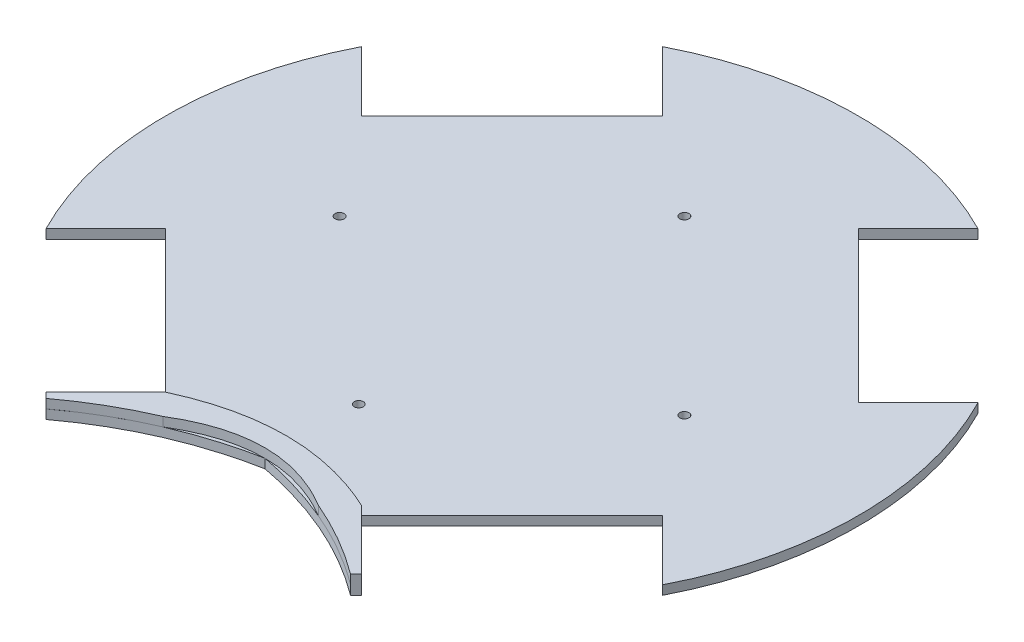
from build123d import *

# Parameters (mm, degrees)
BOSS_EXTRUDE1_DEPTH  = 3
CUT_EXTRUDE2_START   = -3
CUT_EXTRUDE2_DEPTH   = 3
CUT_EXTRUDE3_DEPTH   = 3
BOSS_EXTRUDE22_START = -3
BOSS_EXTRUDE22_DEPTH = 3
BOSS_EXTRUDE23_DEPTH = 3
BOSS_EXTRUDE25_DEPTH = 3
SKETCH9_R            = 1.5
CUT_EXTRUDE7_DEPTH   = 3


# Read off the part's stored shape, not the designer's step: Boss-Extrude22
with BuildPart() as part:
    # Sketch1 → Boss-Extrude1 (new body)
    with BuildSketch(Plane(origin=(0, 0, 0), x_dir=(1, 0, 0), z_dir=(0, 1, 0))):
        with BuildLine():
            Line((-101.290691251, -51.793216568), (-81.630943295, -32.133468612))
            Line((-81.630943295, -32.133468612), (-113.764411907, 0))
            ThreePointArc((-113.764411907, 0), (-110.602028323, -26.637055906), (-101.290691251, -51.793216568))
        make_face()
        with BuildLine():
            ThreePointArc((-101.290691251, 51.793216568), (-110.602028323, 26.637055906), (-113.764411907, 0))
            Line((-113.764411907, 0), (-81.630943295, 32.133468612))
            Line((-81.630943295, 32.133468612), (-101.290691251, 51.793216568))
        make_face()
        with BuildLine():
            Line((-51.793216568, 101.290691251), (-32.133468612, 81.630943295))
            Line((-32.133468612, 81.630943295), (0, 113.764411907))
            ThreePointArc((0, 113.764411907), (-26.637055906, 110.602028323), (-51.793216568, 101.290691251))
        make_face()
        with BuildLine():
            Line((0, 113.764411907), (32.133468612, 81.630943295))
            Line((32.133468612, 81.630943295), (51.793216568, 101.290691251))
            ThreePointArc((51.793216568, 101.290691251), (26.637055906, 110.602028323), (0, 113.764411907))
        make_face()
        with BuildLine():
            Line((101.290691251, 51.793216568), (81.630943295, 32.133468612))
            Line((81.630943295, 32.133468612), (113.764411907, 0))
            ThreePointArc((113.764411907, 0), (110.602028323, 26.637055906), (101.290691251, 51.793216568))
        make_face()
        with BuildLine():
            Line((113.764411907, 0), (81.630943295, -32.133468612))
            Line((81.630943295, -32.133468612), (101.290691251, -51.793216568))
            ThreePointArc((101.290691251, -51.793216568), (110.602028323, -26.637055906), (113.764411907, 0))
        make_face()
        with BuildLine():
            Line((32.133468612, -81.630943295), (0, -113.764411907))
            ThreePointArc((0, -113.764411907), (26.637055906, -110.602028323), (51.793216568, -101.290691251))
            Line((51.793216568, -101.290691251), (32.133468612, -81.630943295))
        make_face()
        Polygon((0, 49.497474683), (-49.497474683, 0), (0, -49.497474683), (49.497474683, 0), align=None)
        Polygon((-81.630943295, -32.133468612), (-56.882205953, -56.882205953), (-32.133468612, -81.630943295), (0, -49.497474683), (-49.497474683, 0), align=None)
        Polygon((-113.764411907, 0), (-81.630943295, -32.133468612), (-49.497474683, 0), (-81.630943295, 32.133468612), align=None)
        Polygon((-32.133468612, 81.630943295), (0, 49.497474683), (32.133468612, 81.630943295), (0, 113.764411907), align=None)
        Polygon((-81.630943295, 32.133468612), (-49.497474683, 0), (0, 49.497474683), (-32.133468612, 81.630943295), align=None)
        Polygon((32.133468612, 81.630943295), (0, 49.497474683), (49.497474683, 0), (81.630943295, 32.133468612), (56.882205953, 56.882205953), align=None)
        Polygon((49.497474683, 0), (0, -49.497474683), (32.133468612, -81.630943295), (56.882205953, -56.882205953), (81.630943295, -32.133468612), align=None)
        Polygon((0, -49.497474683), (-32.133468612, -81.630943295), (0, -113.764411907), (32.133468612, -81.630943295), align=None)
        with BuildLine():
            Line((0, -113.764411907), (-32.133468612, -81.630943295))
            Line((-32.133468612, -81.630943295), (-51.793216568, -101.290691251))
            ThreePointArc((-51.793216568, -101.290691251), (-26.637055906, -110.602028323), (0, -113.764411907))
        make_face()
        Polygon((81.630943295, 32.133468612), (49.497474683, 0), (81.630943295, -32.133468612), (113.764411907, 0), align=None)
    extrude(amount=BOSS_EXTRUDE1_DEPTH)

    # Sketch2 → Cut-Extrude2 (cut)
    with BuildSketch(Plane(origin=(0, 3, 0), x_dir=(1, 0, 0), z_dir=(0, 1, 0)).offset(CUT_EXTRUDE2_START)):
        with BuildLine():
            Line((51.793216568, -101.290691251), (78.845781166, -111.980028466))
            Line((78.845781166, -111.980028466), (0, -134.894819764))
            Line((0, -134.894819764), (-52.523649098, -101.502975393))
            Line((-52.523649098, -101.502975393), (-51.793216568, -101.290691251))
            ThreePointArc((-51.793216568, -101.290691251), (0, -113.764411907), (51.793216568, -101.290691251))
        make_face()
        with BuildLine():
            ThreePointArc((-51.793216568, -101.290691251), (-26.637055906, -110.602028323), (0, -113.764411907))
            Line((0, -113.764411907), (0, -93.764411907))
            add(Edge.make_bspline(
                [(-51.793216568, -101.290691251), (-34.528811045, -96.273171688), (-17.264405523, -93.764411907), (0, -93.764411907)],
                knots=[0, 0, 0, 0, 0.5, 0.5, 0.5, 0.5], degree=3))
        make_face()
        with BuildLine():
            Line((0, -93.764411907), (0, -113.764411907))
            ThreePointArc((0, -113.764411907), (26.637055906, -110.602028323), (51.793216568, -101.290691251))
            add(Edge.make_bspline(
                [(0, -93.764411907), (17.264405523, -93.764411907), (34.528811045, -96.273171688), (51.793216568, -101.290691251)],
                knots=[0.5, 0.5, 0.5, 0.5, 1, 1, 1, 1], degree=3))
        make_face()
    extrude(amount=CUT_EXTRUDE2_DEPTH, mode=Mode.SUBTRACT)

    # Sketch3 → Cut-Extrude3 (cut)
    with BuildSketch(Plane(origin=(0, 3, 0), x_dir=(1, 0, 0), z_dir=(0, 1, 0))):
        with BuildLine():
            add(Edge.make_bspline(
                [(-51.793216568, -101.290691251), (-25.896608284, -81.13041494), (0, -81.13041494)],
                knots=[0, 0, 0, 0.5, 0.5, 0.5], degree=2))
            add(Edge.make_bspline(
                [(-51.793216568, -101.290691251), (-34.528811045, -96.273171688), (-17.264405523, -93.764411907), (0, -93.764411907)],
                knots=[0, 0, 0, 0, 0.5, 0.5, 0.5, 0.5], degree=3))
            Line((0, -93.764411907), (0, -81.13041494))
        make_face()
        with BuildLine():
            add(Edge.make_bspline(
                [(0, -81.13041494), (25.896608284, -81.13041494), (51.793216568, -101.290691251)],
                knots=[0.5, 0.5, 0.5, 1, 1, 1], degree=2))
            Line((0, -81.13041494), (0, -93.764411907))
            add(Edge.make_bspline(
                [(0, -93.764411907), (17.264405523, -93.764411907), (34.528811045, -96.273171688), (51.793216568, -101.290691251)],
                knots=[0.5, 0.5, 0.5, 0.5, 1, 1, 1, 1], degree=3))
        make_face()
        with BuildLine():
            add(Edge.make_bspline(
                [(-51.793216568, -101.290691251), (-34.528811045, -96.273171688), (-17.264405523, -93.764411907), (0, -93.764411907)],
                knots=[0, 0, 0, 0, 0.5, 0.5, 0.5, 0.5], degree=3))
            Line((-51.793216568, -101.290691251), (0, -101.290691251))
            Line((0, -101.290691251), (0, -93.764411907))
        make_face()
        with BuildLine():
            Line((0, -93.764411907), (0, -101.290691251))
            Line((0, -101.290691251), (51.793216568, -101.290691251))
            add(Edge.make_bspline(
                [(0, -93.764411907), (17.264405523, -93.764411907), (34.528811045, -96.273171688), (51.793216568, -101.290691251)],
                knots=[0.5, 0.5, 0.5, 0.5, 1, 1, 1, 1], degree=3))
        make_face()
    extrude(amount=-CUT_EXTRUDE3_DEPTH, mode=Mode.SUBTRACT)

    # Boss-Extrude22 outline → Boss-Extrude22 (add)
    with BuildSketch(Plane(origin=(0, 3, 0), x_dir=(1, 0, 0), z_dir=(0, 1, 0)).offset(BOSS_EXTRUDE22_START)):
        with BuildLine():
            add(Edge.make_bspline(
                [(-51.793216568, -101.290691251), (-25.896608283, -81.130414939), (2e-09, -81.13041494)],
                knots=[0, 0, 0, 0.5, 0.5, 0.5], degree=2))
            Line((-51.793216568, -101.290691251), (-50.025449615, -103.058458204))
            add(Edge.make_bspline(
                [(-50.025449615, -103.058458204), (-27.497808858, -86.339849844), (2e-09, -81.13041494)],
                knots=[0, 0, 0, 1, 1, 1], degree=2))
        make_face()
        with BuildLine():
            add(Edge.make_bspline(
                [(2e-09, -81.13041494), (25.896608285, -81.130414941), (51.793216568, -101.290691251)],
                knots=[0.5, 0.5, 0.5, 1, 1, 1], degree=2))
            add(Edge.make_bspline(
                [(50.025449615, -103.058458204), (27.49780886, -86.339849846), (2e-09, -81.13041494)],
                knots=[0, 0, 0, 1, 1, 1], degree=2))
            Line((50.025449615, -103.058458204), (51.793216568, -101.290691251))
        make_face()
        with BuildLine():
            add(Edge.make_bspline(
                [(-51.793216568, -101.290691251), (-50.163270872, -99.558123101), (-48.475496542, -97.972971225)],
                knots=[0, 0, 0, 0.0773713, 0.0773713, 0.0773713], degree=2))
            Line((-51.793216568, -101.290691251), (-48.475496542, -97.972971225))
        make_face()
    extrude(amount=BOSS_EXTRUDE22_DEPTH)

    # Sketch7 → Boss-Extrude23 (add)
    with BuildSketch(Plane(origin=(0, 3, 0), x_dir=(1, 0, 0), z_dir=(0, 1, 0))):
        with BuildLine():
            Line((-51.793216568, -101.290691251), (-32.133468612, -81.630943295))
            Line((-32.133468612, -81.630943295), (-25.659536996, -88.957948864))
            add(Edge.make_bspline(
                [(-25.659536996, -88.957948864), (-38.659028178, -94.595891725), (-50.025449615, -103.058458204)],
                knots=[0, 0, 0, 1, 1, 1], degree=2))
            Line((-50.025449615, -103.058458204), (-51.793216568, -101.290691251))
        make_face()
        with BuildLine():
            Line((32.133468612, -81.630943295), (25.062400804, -88.702011103))
            add(Edge.make_bspline(
                [(25.062400804, -88.702011103), (38.389944956, -94.394049191), (50.025449615, -103.058458204)],
                knots=[0, 0, 0, 1, 1, 1], degree=2))
            Line((50.025449615, -103.058458204), (51.793216568, -101.290691251))
            Line((51.793216568, -101.290691251), (32.133468612, -81.630943295))
        make_face()
    extrude(amount=BOSS_EXTRUDE23_DEPTH)

    # Sketch8 → Boss-Extrude25 (add)
    with BuildSketch(Plane(origin=(0, 6, 0), x_dir=(1, 0, 0), z_dir=(0, 1, 0))):
        with BuildLine():
            add(Edge.make_bspline(
                [(-25.659536996, -88.957948864), (-0.319320436, -73.431682627), (25.062400804, -88.702011103)],
                knots=[0, 0, 0, 1, 1, 1], degree=2))
            Line((25.062400804, -88.702011103), (32.133468612, -81.630943295))
            add(Edge.make_bspline(
                [(-32.133468612, -81.630943295), (0, -66.739709001), (32.133468612, -81.630943295)],
                knots=[0, 0, 0, 1, 1, 1], degree=2))
            Line((-32.133468612, -81.630943295), (-25.659536996, -88.957948864))
        make_face()
    extrude(amount=-BOSS_EXTRUDE25_DEPTH)

    # Sketch9 → Cut-Extrude7 (cut)
    with BuildSketch(Plane(origin=(0, 3, 0), x_dir=(1, 0, 0), z_dir=(0, 1, 0))):
        with Locations(Location((0, -50.335766678, 0), (0, 0, 270))):
            Circle(SKETCH9_R)
        with Locations(Location((-56.630943295, 0, 0), (0, 0, 270))):
            Circle(SKETCH9_R)
        with Locations(Location((0, 56.630943295, 0), (0, 0, 270))):
            Circle(SKETCH9_R)
        with Locations(Location((56.630943295, 0, 0), (0, 0, 270))):
            Circle(SKETCH9_R)
    extrude(amount=-CUT_EXTRUDE7_DEPTH, mode=Mode.SUBTRACT)


solid = part.part
